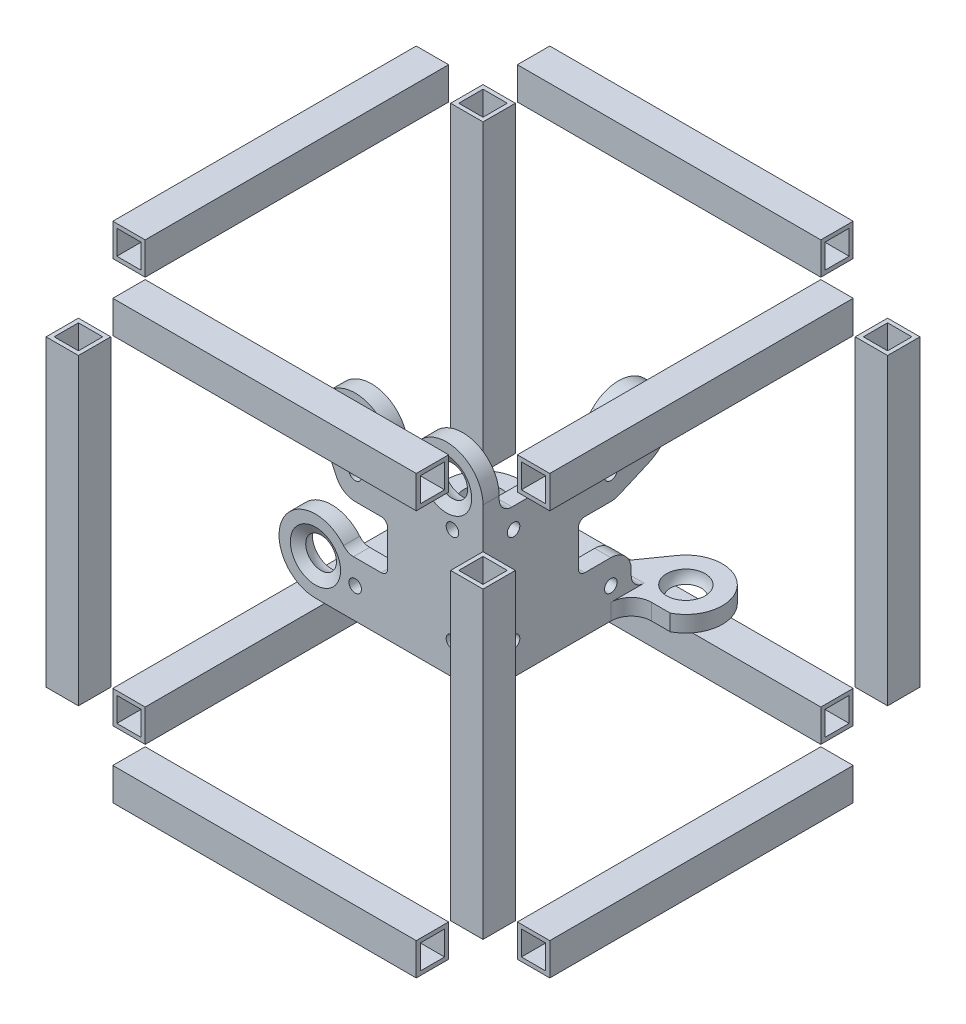
from build123d import *

# Parameters (mm, degrees)
TUBES1_START          = -12.5
SKETCH1_W             = 8
SKETCH1_H             = 8
SKETCH1_W_2           = 6
SKETCH1_H_2           = 6
TUBES1_DEPTH          = 75
TUBES1_2_DEPTH        = 75
TUBES1_3_DEPTH        = 75
TUBES1_4_DEPTH        = 75
TUBES2_START          = -16.5
SKETCH9_W             = 8
SKETCH9_H             = 8
SKETCH9_W_2           = 6
SKETCH9_H_2           = 6
TUBES2_DEPTH          = 75
TUBES2_2_DEPTH        = 75
TUBES2_3_DEPTH        = 75
TUBES2_4_DEPTH        = 75
TUBES3_START          = 16.5
SKETCH10_W            = 8
SKETCH10_H            = 8
SKETCH10_W_2          = 6
SKETCH10_H_2          = 6
TUBES3_DEPTH          = 75
TUBES3_2_DEPTH        = 75
TUBES3_3_DEPTH        = 75
TUBES3_4_DEPTH        = 75
SKETCH12_R            = 1.55
BOSS_EXTRUDE6_DEPTH   = 4
BODY_MOVE_COPY1_ANGLE = 180
BODY_MOVE_COPY3_ANGLE = 120
BOSS_EXTRUDE7_DEPTH   = 36.64081528
CUT_EXTRUDE1_START    = -4
SKETCH18_R            = 1.55
SKETCH18_W            = 13.07081528
SKETCH18_H            = 12
CUT_EXTRUDE1_DEPTH    = 2.499185
CUT_EXTRUDE2_START    = -4
SKETCH19_R            = 1.55
SKETCH19_W            = 13.07081528
SKETCH19_H            = 12
CUT_EXTRUDE2_DEPTH    = 2.499185
FILLET2_R             = 5.05
CHAMFER1_SIZE         = 0.93
SKETCH27_R            = 3.175
CABLE1_DEPTH          = 4
SKETCH28_R            = 3.175
CABLE2_DEPTH          = 4
SKETCH29_R            = 3.175
CABLE_3_DEPTH         = 4
CABLE_START           = -16.928203
SKETCH33_R            = 1.75
CABLE_5_DEPTH         = 9.115197
SKETCH34_R            = 3.175
CABLE6_DEPTH          = 4
SKETCH35_R            = 3.175
CABLE7_DEPTH          = 4
FILLET4_R             = 1.5875
SKETCH43_R            = 3.175
CABLE_4_DEPTH         = 4
CHAMFER2_SIZE         = 3.031088913
CHAMFER2_SIZE_2       = 1.75
FILLET6_R             = 6.35
FILLET7_R             = 3.175
FILLET8_R             = 5


with BuildPart() as part:
    # Sketch1 → Tubes1 (new body)
    with BuildSketch(Plane.XY.offset(50).offset(TUBES1_START)):
        with Locations((-50, 50)):
            Rectangle(SKETCH1_W, SKETCH1_H)
        with Locations((-50, 50)):
            Rectangle(SKETCH1_W_2, SKETCH1_H_2, mode=Mode.SUBTRACT)
    extrude(amount=-TUBES1_DEPTH)


with BuildPart() as body_2:
    # Sketch1 → Tubes1 2 (new body)
    with BuildSketch(Plane.XY.offset(50).offset(TUBES1_START)):
        with Locations((50, 50)):
            Rectangle(SKETCH1_W, SKETCH1_H)
        with Locations((50, 50)):
            Rectangle(SKETCH1_W_2, SKETCH1_H_2, mode=Mode.SUBTRACT)
    extrude(amount=-TUBES1_2_DEPTH)


with BuildPart() as body_3:
    # Sketch1 → Tubes1 3 (new body)
    with BuildSketch(Plane.XY.offset(50).offset(TUBES1_START)):
        with Locations((50, -50)):
            Rectangle(SKETCH1_W, SKETCH1_H)
        with Locations((50, -50)):
            Rectangle(SKETCH1_W_2, SKETCH1_H_2, mode=Mode.SUBTRACT)
    extrude(amount=-TUBES1_3_DEPTH)


with BuildPart() as body_4:
    # Sketch1 → Tubes1 4 (new body)
    with BuildSketch(Plane.XY.offset(50).offset(TUBES1_START)):
        with Locations((-50, -50)):
            Rectangle(SKETCH1_W, SKETCH1_H)
        with Locations((-50, -50)):
            Rectangle(SKETCH1_W_2, SKETCH1_H_2, mode=Mode.SUBTRACT)
    extrude(amount=-TUBES1_4_DEPTH)


with BuildPart() as body_5:
    # Sketch9 → Tubes2 (new body)
    with BuildSketch(Plane(origin=(0, -54, 0), x_dir=(0, 0, -1), z_dir=(0, -1, 0)).offset(TUBES2_START)):
        with Locations((-50, 50)):
            Rectangle(SKETCH9_W, SKETCH9_H)
        with Locations((-50, 50)):
            Rectangle(SKETCH9_W_2, SKETCH9_H_2, mode=Mode.SUBTRACT)
    extrude(amount=-TUBES2_DEPTH)


with BuildPart() as body_6:
    # Sketch9 → Tubes2 2 (new body)
    with BuildSketch(Plane(origin=(0, -54, 0), x_dir=(0, 0, -1), z_dir=(0, -1, 0)).offset(TUBES2_START)):
        with Locations((50, 50)):
            Rectangle(SKETCH9_W, SKETCH9_H)
        with Locations((50, 50)):
            Rectangle(SKETCH9_W_2, SKETCH9_H_2, mode=Mode.SUBTRACT)
    extrude(amount=-TUBES2_2_DEPTH)


with BuildPart() as body_7:
    # Sketch9 → Tubes2 3 (new body)
    with BuildSketch(Plane(origin=(0, -54, 0), x_dir=(0, 0, -1), z_dir=(0, -1, 0)).offset(TUBES2_START)):
        with Locations((50, -50)):
            Rectangle(SKETCH9_W, SKETCH9_H)
        with Locations((50, -50)):
            Rectangle(SKETCH9_W_2, SKETCH9_H_2, mode=Mode.SUBTRACT)
    extrude(amount=-TUBES2_3_DEPTH)


with BuildPart() as body_8:
    # Sketch9 → Tubes2 4 (new body)
    with BuildSketch(Plane(origin=(0, -54, 0), x_dir=(0, 0, -1), z_dir=(0, -1, 0)).offset(TUBES2_START)):
        with Locations((-50, -50)):
            Rectangle(SKETCH9_W, SKETCH9_H)
        with Locations((-50, -50)):
            Rectangle(SKETCH9_W_2, SKETCH9_H_2, mode=Mode.SUBTRACT)
    extrude(amount=-TUBES2_4_DEPTH)


with BuildPart() as body_9:
    # Sketch10 → Tubes3 (new body)
    with BuildSketch(Plane(origin=(-54, 0, 0), x_dir=(0, -1, 0), z_dir=(1, 0, 0)).offset(TUBES3_START)):
        with Locations((-50, 50)):
            Rectangle(SKETCH10_W, SKETCH10_H)
        with Locations((-50, 50)):
            Rectangle(SKETCH10_W_2, SKETCH10_H_2, mode=Mode.SUBTRACT)
    extrude(amount=TUBES3_DEPTH)


with BuildPart() as body_10:
    # Sketch10 → Tubes3 2 (new body)
    with BuildSketch(Plane(origin=(-54, 0, 0), x_dir=(0, -1, 0), z_dir=(1, 0, 0)).offset(TUBES3_START)):
        with Locations((50, 50)):
            Rectangle(SKETCH10_W, SKETCH10_H)
        with Locations((50, 50)):
            Rectangle(SKETCH10_W_2, SKETCH10_H_2, mode=Mode.SUBTRACT)
    extrude(amount=TUBES3_2_DEPTH)


with BuildPart() as body_11:
    # Sketch10 → Tubes3 3 (new body)
    with BuildSketch(Plane(origin=(-54, 0, 0), x_dir=(0, -1, 0), z_dir=(1, 0, 0)).offset(TUBES3_START)):
        with Locations((50, -50)):
            Rectangle(SKETCH10_W, SKETCH10_H)
        with Locations((50, -50)):
            Rectangle(SKETCH10_W_2, SKETCH10_H_2, mode=Mode.SUBTRACT)
    extrude(amount=TUBES3_3_DEPTH)


with BuildPart() as body_12:
    # Sketch10 → Tubes3 4 (new body)
    with BuildSketch(Plane(origin=(-54, 0, 0), x_dir=(0, -1, 0), z_dir=(1, 0, 0)).offset(TUBES3_START)):
        with Locations((-50, -50)):
            Rectangle(SKETCH10_W, SKETCH10_H)
        with Locations((-50, -50)):
            Rectangle(SKETCH10_W_2, SKETCH10_H_2, mode=Mode.SUBTRACT)
    extrude(amount=TUBES3_4_DEPTH)


with BuildPart() as body_13:
    # Sketch12 → Boss-Extrude6 (new body)
    with BuildSketch(Plane.ZY.offset(-19.57)):
        Polygon((17.07081528, -17.07081528), (17.07081528, 17.07081528), (-17.07081528, 17.07081528), (-17.07081528, 6), (-4, 6), (-4, -6), (-17.07081528, -6), (-17.07081528, -17.07081528), align=None)
        with Locations(Location((-12.02081528, -12.02081528, 0), (0, 0, 270))):
            Circle(SKETCH12_R, mode=Mode.SUBTRACT)
        with Locations(Location((12.02081528, -12.02081528, 0), (0, 0, 270))):
            Circle(SKETCH12_R, mode=Mode.SUBTRACT)
        with Locations(Location((12.02081528, 12.02081528, 0), (0, 0, 270))):
            Circle(SKETCH12_R, mode=Mode.SUBTRACT)
        with Locations(Location((-12.02081528, 12.02081528, 0), (0, 0, 270))):
            Circle(SKETCH12_R, mode=Mode.SUBTRACT)
    extrude(amount=BOSS_EXTRUDE6_DEPTH)


with BuildPart() as body_14:
    # Body-Move/Copy1: copy of body 13
    add(body_13.part.moved(Location((0, 0, 0))).rotate(Axis((9.285, 0, -9.285), (0.7071067811865488, 0, 0.7071067811865462)), BODY_MOVE_COPY1_ANGLE))


with BuildPart() as body_14_1:
    # Body-Move/Copy2: moved
    add(body_14.part.moved(Location((-18.57, 0, 18.57))))


with BuildPart() as body_15:
    # Body-Move/Copy3: copy of body 14
    add(body_14_1.part.moved(Location((0, 0, 0))).rotate(Axis((-6.19, 6.19, 12.38), (0.5773502691896252, -0.5773502691896252, 0.5773502691896272)), BODY_MOVE_COPY3_ANGLE))


with BuildPart() as body_15_1:
    # Body-Move/Copy4: moved
    add(body_15.part.moved(Location((0, -18.57, -18.57))))

    # Combine1: union body 14, body 13
    add(body_14_1.part)
    add(body_13.part)

    # Sketch13 → Boss-Extrude7 (add)
    with BuildSketch(Plane.XZ.offset(19.57)):
        Polygon((19.57, 19.57), (-17.07081528, 19.57), (-17.07081528, 17.07081528), (17.07081528, 17.07081528), (17.07081528, -17.07081528), (19.57, -17.07081528), (19.57, 17.07081528), align=None)
    extrude(amount=-BOSS_EXTRUDE7_DEPTH)

    # Sketch18 → Cut-Extrude1 (cut)
    with BuildSketch(Plane(origin=(0, 0, 15.57), x_dir=(-1, 0, 0), z_dir=(0, 0, -1)).offset(CUT_EXTRUDE1_START)):
        with Locations((-12.02081528, 12.02081528)):
            Circle(SKETCH18_R)
        with Locations((12.02081528, 12.02081528)):
            Circle(SKETCH18_R)
        with Locations((12.02081528, -12.02081528)):
            Circle(SKETCH18_R)
        with Locations((-12.02081528, -12.02081528)):
            Circle(SKETCH18_R)
        with Locations((10.53540764, 0)):
            Rectangle(SKETCH18_W, SKETCH18_H)
    extrude(amount=CUT_EXTRUDE1_DEPTH, mode=Mode.SUBTRACT)

    # Sketch19 → Cut-Extrude2 (cut)
    with BuildSketch(Plane.ZY.offset(-15.57).offset(CUT_EXTRUDE2_START)):
        with Locations(Location((-12.02081528, 12.02081528, 0), (0, 0, 270))):
            Circle(SKETCH19_R)
        with Locations(Location((12.02081528, 12.02081528, 0), (0, 0, 270))):
            Circle(SKETCH19_R)
        with Locations(Location((12.02081528, -12.02081528, 0), (0, 0, 270))):
            Circle(SKETCH19_R)
        with Locations(Location((-12.02081528, -12.02081528, 0), (0, 0, 270))):
            Circle(SKETCH19_R)
        with Locations((-10.53540764, 0)):
            Rectangle(SKETCH19_W, SKETCH19_H)
    extrude(amount=CUT_EXTRUDE2_DEPTH, mode=Mode.SUBTRACT)

    # Fillet2
    fillet2_edges = [body_15_1.edges().sort_by_distance(p)[0] for p in [
        (6, -17.57, -17.07081528),
        (-17.07081528, -17.57, -17.07081528),
        (-6, -17.57, -17.07081528),
        (17.57, -6, -17.07081528),
        (-17.07081528, 6, 17.57),
        (-17.07081528, 17.07081528, 17.57),
        (-17.07081528, -6, 17.57),
        (17.57, 17.07081528, -17.07081528),
        (17.57, 6, -17.07081528),
    ]]
    fillet(fillet2_edges, radius=FILLET2_R)

    # Chamfer1
    # the kernel refuses this chamfer: 0.93 mm, written as the material it takes off along each edge
    with BuildSketch(Plane(origin=(12.02081528, -15.57, -12.02081528), x_dir=(-1, 0, 0), z_dir=(0, 0, -1))) as chamfer1_piece_1:
        Polygon((1.55, -CHAMFER1_SIZE), (1.55 + CHAMFER1_SIZE, 0), (1.55, 0), align=None)
    revolve(axis=Axis((12.02081528, -15.57, -12.02081528), (0, 1, 0)), mode=Mode.SUBTRACT)
    with BuildSketch(Plane(origin=(12.02081528, -15.57, 12.02081528), x_dir=(-1, 0, 0), z_dir=(0, 0, -1))) as chamfer1_piece_2:
        Polygon((1.55, -CHAMFER1_SIZE), (1.55 + CHAMFER1_SIZE, 0), (1.55, 0), align=None)
    revolve(axis=Axis((12.02081528, -15.57, 12.02081528), (0, 1, 0)), mode=Mode.SUBTRACT)
    with BuildSketch(Plane(origin=(-12.02081528, -15.57, 12.02081528), x_dir=(-1, 0, 0), z_dir=(0, 0, -1))) as chamfer1_piece_3:
        Polygon((1.55, -CHAMFER1_SIZE), (1.55 + CHAMFER1_SIZE, 0), (1.55, 0), align=None)
    revolve(axis=Axis((-12.02081528, -15.57, 12.02081528), (0, 1, 0)), mode=Mode.SUBTRACT)
    with BuildSketch(Plane(origin=(-12.02081528, -15.57, -12.02081528), x_dir=(-1, 0, 0), z_dir=(0, 0, -1))) as chamfer1_piece_4:
        Polygon((1.55, -CHAMFER1_SIZE), (1.55 + CHAMFER1_SIZE, 0), (1.55, 0), align=None)
    revolve(axis=Axis((-12.02081528, -15.57, -12.02081528), (0, 1, 0)), mode=Mode.SUBTRACT)
    with BuildSketch(Plane(origin=(-12.02081528, 12.02081528, 15.57), x_dir=(0, 1, 0), z_dir=(-1, 0, 0))) as chamfer1_piece_5:
        Polygon((1.55, -CHAMFER1_SIZE), (1.55 + CHAMFER1_SIZE, 0), (1.55, 0), align=None)
    revolve(axis=Axis((-12.02081528, 12.02081528, 15.57), (0, 0, -1)), mode=Mode.SUBTRACT)
    with BuildSketch(Plane(origin=(12.02081528, 12.02081528, 15.57), x_dir=(0, 1, 0), z_dir=(-1, 0, 0))) as chamfer1_piece_6:
        Polygon((1.55, -CHAMFER1_SIZE), (1.55 + CHAMFER1_SIZE, 0), (1.55, 0), align=None)
    revolve(axis=Axis((12.02081528, 12.02081528, 15.57), (0, 0, -1)), mode=Mode.SUBTRACT)
    with BuildSketch(Plane(origin=(12.02081528, -12.02081528, 15.57), x_dir=(0, 1, 0), z_dir=(-1, 0, 0))) as chamfer1_piece_7:
        Polygon((1.55, -CHAMFER1_SIZE), (1.55 + CHAMFER1_SIZE, 0), (1.55, 0), align=None)
    revolve(axis=Axis((12.02081528, -12.02081528, 15.57), (0, 0, -1)), mode=Mode.SUBTRACT)
    with BuildSketch(Plane(origin=(-12.02081528, -12.02081528, 15.57), x_dir=(0, 1, 0), z_dir=(-1, 0, 0))) as chamfer1_piece_8:
        Polygon((1.55, -CHAMFER1_SIZE), (1.55 + CHAMFER1_SIZE, 0), (1.55, 0), align=None)
    revolve(axis=Axis((-12.02081528, -12.02081528, 15.57), (0, 0, -1)), mode=Mode.SUBTRACT)
    with BuildSketch(Plane(origin=(15.57, -12.02081528, -12.02081528), x_dir=(0, -1, 0), z_dir=(0, 0, -1))) as chamfer1_piece_9:
        Polygon((1.55 + CHAMFER1_SIZE, 0), (1.55, -CHAMFER1_SIZE), (1.55, 0), align=None)
    revolve(axis=Axis((15.57, -12.02081528, -12.02081528), (-1, 0, 0)), mode=Mode.SUBTRACT)
    with BuildSketch(Plane(origin=(15.57, -12.02081528, 12.02081528), x_dir=(0, -1, 0), z_dir=(0, 0, -1))) as chamfer1_piece_10:
        Polygon((1.55 + CHAMFER1_SIZE, 0), (1.55, -CHAMFER1_SIZE), (1.55, 0), align=None)
    revolve(axis=Axis((15.57, -12.02081528, 12.02081528), (-1, 0, 0)), mode=Mode.SUBTRACT)
    with BuildSketch(Plane(origin=(15.57, 12.02081528, 12.02081528), x_dir=(0, -1, 0), z_dir=(0, 0, -1))) as chamfer1_piece_11:
        Polygon((1.55 + CHAMFER1_SIZE, 0), (1.55, -CHAMFER1_SIZE), (1.55, 0), align=None)
    revolve(axis=Axis((15.57, 12.02081528, 12.02081528), (-1, 0, 0)), mode=Mode.SUBTRACT)
    with BuildSketch(Plane(origin=(15.57, 12.02081528, -12.02081528), x_dir=(0, -1, 0), z_dir=(0, 0, -1))) as chamfer1_piece_12:
        Polygon((1.55 + CHAMFER1_SIZE, 0), (1.55, -CHAMFER1_SIZE), (1.55, 0), align=None)
    revolve(axis=Axis((15.57, 12.02081528, -12.02081528), (-1, 0, 0)), mode=Mode.SUBTRACT)

    # Sketch27 → Cable1 (add)
    with BuildSketch(Plane(origin=(0, 0, 15.57), x_dir=(-1, 0, 0), z_dir=(0, 0, -1))):
        with BuildLine():
            Line((20.149230994, 16.387027244), (16.581759653, 8.881985602))
            ThreePointArc((16.581759653, 8.881985602), (16.947034372, 9.938754996), (17.07081528, 11.05))
            Line((17.07081528, 11.05), (17.07081528, 12.02081528))
            ThreePointArc((17.07081528, 12.02081528), (15.591704525, 15.591704525), (12.02081528, 17.07081528))
            Line((12.02081528, 17.07081528), (3.02081528, 17.07081528))
            Line((3.02081528, 17.07081528), (3.02081528, 20.25081528))
            ThreePointArc((3.02081528, 20.25081528), (14.001251921, 29.030215642), (20.149230994, 16.387027244))
        make_face()
        with Locations((12.02081528, 20.25081528)):
            Circle(SKETCH27_R, mode=Mode.SUBTRACT)
    extrude(amount=-CABLE1_DEPTH)

    # Sketch28 → Cable2 (add)
    with BuildSketch(Plane(origin=(0, 0, 15.57), x_dir=(-1, 0, 0), z_dir=(0, 0, -1))):
        with BuildLine():
            Line((-19.57, 21.07081528), (-19.57, 17.07081528))
            Line((-19.57, 17.07081528), (-1.57, 17.07081528))
            Line((-1.57, 17.07081528), (-1.57, 21.07081528))
            ThreePointArc((-1.57, 21.07081528), (-10.57, 30.07081528), (-19.57, 21.07081528))
        make_face()
        with Locations((-10.57, 21.07081528)):
            Circle(SKETCH28_R, mode=Mode.SUBTRACT)
    extrude(amount=-CABLE2_DEPTH)

    # Sketch33 → Cable 5 (cut)
    with BuildSketch(Plane(origin=(9.796487764, -9.796502297, 9.796501863), x_dir=(0.8164969786402893, 0.4082479017987434, -0.4082478837032751), z_dir=(-0.5773497067387141, 0.577350563210323, -0.577350537619429)).offset(CABLE_START)):
        with Locations(Location((0, 0, 0), (0, 0, 267.911468754))):
            Circle(SKETCH33_R)
    extrude(amount=CABLE_5_DEPTH, mode=Mode.SUBTRACT)

    # Sketch34 → Cable6 (add)
    with BuildSketch(Plane(origin=(0, 0, 15.57), x_dir=(-1, 0, 0), z_dir=(0, 0, -1))):
        with BuildLine():
            Line((17.07081528, -19.57), (21.84081528, -19.57))
            ThreePointArc((21.84081528, -19.57), (29.655225047, -6.10513718), (14.087422474, -6))
            Line((14.087422474, -6), (12.02081528, -6))
            ThreePointArc((12.02081528, -6), (15.591704525, -7.479110755), (17.07081528, -11.05))
            Line((17.07081528, -11.05), (17.07081528, -15.57))
            Line((17.07081528, -15.57), (17.07081528, -19.57))
        make_face()
        with Locations((21.84081528, -10.57)):
            Circle(SKETCH34_R, mode=Mode.SUBTRACT)
    extrude(amount=-CABLE6_DEPTH)

    # Sketch35 → Cable7 (add)
    with BuildSketch(Plane(origin=(0, -15.57, 0), x_dir=(1, 0, 0), z_dir=(0, 1, 0))):
        with BuildLine():
            Line((-17.07081528, 12.02081528), (-17.07081528, 4.344523779))
            Line((-17.07081528, 4.344523779), (-24.383145751, 11.656854249))
            ThreePointArc((-24.383145751, 11.656854249), (-21.463335611, 26.335731073), (-9.01918472, 18.02081528))
            Line((-9.01918472, 18.02081528), (-9.01918472, 16.644481498))
            ThreePointArc((-9.01918472, 16.644481498), (-10.012458291, 16.963082695), (-11.05, 17.07081528))
            Line((-11.05, 17.07081528), (-12.02081528, 17.07081528))
            ThreePointArc((-12.02081528, 17.07081528), (-15.591704525, 15.591704525), (-17.07081528, 12.02081528))
        make_face()
        with Locations(Location((-18.01918472, 18.02081528, 0), (0, 0, 270))):
            Circle(SKETCH35_R, mode=Mode.SUBTRACT)
    extrude(amount=-CABLE7_DEPTH)

    # Sketch37 → Cable 1 (revolve, cut)
    with BuildSketch(Plane(origin=(-12.02081528, 0, 0), x_dir=(0, 0, -1), z_dir=(1, 0, 0))):
        with BuildLine():
            Line((-20.07, 20.25081528), (-10.545, 20.25081528))
            ThreePointArc((-10.545, 20.25081528), (-15.3075, 25.01331528), (-20.07, 20.25081528))
        make_face()
    revolve(axis=Axis((-12.02081528, 20.25081528, 20.07), (0, 0, -1)), mode=Mode.SUBTRACT)

    # Sketch38 → Cable 2 (revolve, cut)
    with BuildSketch(Plane.ZY.offset(-10.57)):
        with BuildLine():
            Line((10.545, 21.07081528), (20.07, 21.07081528))
            ThreePointArc((20.07, 21.07081528), (15.3075, 25.83331528), (10.545, 21.07081528))
        make_face()
    revolve(axis=Axis((10.57, 21.07081528, 10.545), (0, 0, 1)), mode=Mode.SUBTRACT)


with BuildPart() as body_14_2:
    # Sketch29 → Cable 3 (new body)
    with BuildSketch(Plane.ZY.offset(-15.57)):
        with BuildLine():
            Line((-21.506894245, 9.66682592), (-14.033918958, 6.418594859))
            ThreePointArc((-14.033918958, 6.418594859), (-16.243887241, 8.280855148), (-17.07081528, 11.05))
            Line((-17.07081528, 11.05), (-17.07081528, 12.02081528))
            ThreePointArc((-17.07081528, 12.02081528), (-15.591704525, 15.591704525), (-12.02081528, 17.07081528))
            Line((-12.02081528, 17.07081528), (-4.341262658, 17.07081528))
            Line((-4.341262658, 17.07081528), (-11.555223689, 24.284776311))
            ThreePointArc((-11.555223689, 24.284776311), (-25.35880914, 22.985594494), (-21.506894245, 9.66682592))
        make_face()
        with Locations(Location((-17.91918472, 17.92081528, 0), (0, 0, 270))):
            Circle(SKETCH29_R, mode=Mode.SUBTRACT)
    extrude(amount=-CABLE_3_DEPTH)


with BuildPart() as cable3_tool:
    # Sketch39 → Cable3 (revolve)
    with BuildSketch(Plane(origin=(0, 0, -17.91918472), x_dir=(-1, 0, 0), z_dir=(0, 0, -1))):
        with BuildLine():
            Line((-20.07, 17.92081528), (-10.545, 17.92081528))
            ThreePointArc((-10.545, 17.92081528), (-15.3075, 22.68331528), (-20.07, 17.92081528))
        make_face()
    revolve(axis=Axis((20.07, 17.92081528, -17.91918472), (-1, 0, 0)))


with BuildPart() as body_15_2:
    add(body_15_1.part)

    # Cable3: cut by cable3_tool
    add(cable3_tool.part, mode=Mode.SUBTRACT)


with BuildPart() as body_14_2_1:
    add(body_14_2.part)

    # Cable3: cut by cable3_tool
    add(cable3_tool.part, mode=Mode.SUBTRACT)


with BuildPart() as body_15_3:
    add(body_15_2.part)

    # Combine2: union body 14 2
    add(body_14_2_1.part)

    # Sketch41 → cable5 (revolve, cut)
    with BuildSketch(Plane.ZY.offset(18.01918472)):
        with BuildLine():
            Line((-18.02081528, -10.545), (-18.02081528, -20.07))
            ThreePointArc((-18.02081528, -20.07), (-22.78331528, -15.3075), (-18.02081528, -10.545))
        make_face()
    revolve(axis=Axis((-18.01918472, -10.545, -18.02081528), (0, -1, 0)), mode=Mode.SUBTRACT)

    # Sketch42 → cable 6 (revolve, cut)
    with BuildSketch(Plane.ZY.offset(21.84081528)):
        with BuildLine():
            Line((10.545, -10.57), (20.07, -10.57))
            ThreePointArc((20.07, -10.57), (15.3075, -5.8075), (10.545, -10.57))
        make_face()
    revolve(axis=Axis((-21.84081528, -10.57, 10.545), (0, 0, 1)), mode=Mode.SUBTRACT)

    # Fillet4
    fillet4_edges = [body_15_3.edges().sort_by_distance(p)[0] for p in [
        (-6, -17.57, -4),
        (6, -17.57, -4),
        (-4, 6, 17.57),
        (-4, -6, 17.57),
        (17.57, -6, -4),
        (17.57, 6, -4),
    ]]
    fillet(fillet4_edges, radius=FILLET4_R)

    # Sketch43 → Cable 4 (add)
    with BuildSketch(Plane(origin=(0, -15.57, 0), x_dir=(1, 0, 0), z_dir=(0, 1, 0))):
        with BuildLine():
            Line((17.711377599, 30.251781716), (6.920995209, 14.928360539))
            ThreePointArc((6.920995209, 14.928360539), (8.724124203, 16.503314781), (11.05, 17.07081528))
            Line((11.05, 17.07081528), (19.57, 17.07081528))
            Line((19.57, 17.07081528), (29.194652426, 17.07081528))
            ThreePointArc((29.194652426, 17.07081528), (31.855949417, 30.981945705), (17.711377599, 30.251781716))
        make_face()
        with Locations(Location((25.07, 25.070017888, 0), (0, 0, 270))):
            Circle(SKETCH43_R, mode=Mode.SUBTRACT)
    extrude(amount=-CABLE_4_DEPTH)

    # Sketch44 → cable4 (revolve, cut)
    with BuildSketch(Plane(origin=(25.07, 0, 0), x_dir=(0, 0, -1), z_dir=(1, 0, 0))):
        with BuildLine():
            Line((25.070017888, -10.545), (25.070017888, -20.07))
            ThreePointArc((25.070017888, -20.07), (20.307517888, -15.3075), (25.070017888, -10.545))
        make_face()
    revolve(axis=Axis((25.07, -10.545, -25.070017888), (0, -1, 0)), mode=Mode.SUBTRACT)

    # Chamfer2
    # the kernel refuses this chamfer: 3.031088913, 1.75 mm, written as the material it takes off along each edge
    with BuildSketch(Plane(origin=(-21.84081528, -10.57, 19.57), x_dir=(-1, 0, 0), z_dir=(0, -1, 0))) as chamfer2_piece_1:
        Polygon((3.175 + CHAMFER2_SIZE, 0), (3.175, CHAMFER2_SIZE_2), (3.175, 0), align=None)
    revolve(axis=Axis((-21.84081528, -10.57, 19.57), (0, 0, -1)), mode=Mode.SUBTRACT)
    with BuildSketch(Plane(origin=(-12.02081528, 20.25081528, 19.57), x_dir=(-1, 0, 0), z_dir=(0, -1, 0))) as chamfer2_piece_2:
        Polygon((3.175 + CHAMFER2_SIZE, 0), (3.175, CHAMFER2_SIZE_2), (3.175, 0), align=None)
    revolve(axis=Axis((-12.02081528, 20.25081528, 19.57), (0, 0, -1)), mode=Mode.SUBTRACT)
    with BuildSketch(Plane(origin=(10.57, 21.07081528, 19.57), x_dir=(-1, 0, 0), z_dir=(0, -1, 0))) as chamfer2_piece_3:
        Polygon((3.175 + CHAMFER2_SIZE, 0), (3.175, CHAMFER2_SIZE_2), (3.175, 0), align=None)
    revolve(axis=Axis((10.57, 21.07081528, 19.57), (0, 0, -1)), mode=Mode.SUBTRACT)
    with BuildSketch(Plane(origin=(19.57, 17.92081528, -17.91918472), x_dir=(0, -1, 0), z_dir=(0, 0, -1))) as chamfer2_piece_4:
        Polygon((3.175 + CHAMFER2_SIZE, 0), (3.175, CHAMFER2_SIZE_2), (3.175, 0), align=None)
    revolve(axis=Axis((19.57, 17.92081528, -17.91918472), (-1, 0, 0)), mode=Mode.SUBTRACT)
    with BuildSketch(Plane(origin=(-18.01918472, -19.57, -18.02081528), x_dir=(0, 0, 1), z_dir=(-1, 0, 0))) as chamfer2_piece_5:
        Polygon((3.175 + CHAMFER2_SIZE, 0), (3.175, CHAMFER2_SIZE_2), (3.175, 0), align=None)
    revolve(axis=Axis((-18.01918472, -19.57, -18.02081528), (0, 1, 0)), mode=Mode.SUBTRACT)
    with BuildSketch(Plane(origin=(25.07, -19.57, -25.070017888), x_dir=(0, 0, 1), z_dir=(-1, 0, 0))) as chamfer2_piece_6:
        Polygon((3.175 + CHAMFER2_SIZE, 0), (3.175, CHAMFER2_SIZE_2), (3.175, 0), align=None)
    revolve(axis=Axis((25.07, -19.57, -25.070017888), (0, 1, 0)), mode=Mode.SUBTRACT)

    # Fillet6
    # the kernel refuses this fillet: 6.35 mm, written as the material it adds along each edge
    with BuildSketch(Plane(origin=(-17.07081528, -15.57, -4.344523779), x_dir=(-0.7071067811865492, -4.872621993956222e-15, -0.7071067811865458), z_dir=(0, -1, 0))) as fillet6_piece_1:
        with BuildLine():
            CenterArc((FILLET6_R * 0.414213562373, -FILLET6_R), FILLET6_R, 90, 45)
            Line((-FILLET6_R * 0.292893218813, -FILLET6_R * 0.292893218813), (0, 0))
            Line((0, 0), (FILLET6_R * 0.414213562373, 0))
        make_face()
    extrude(amount=4)
    with BuildSketch(Plane(origin=(-9.01918472, -15.57, -16.644481498), x_dir=(0.8180891707136062, 4.788971450513196e-15, 0.5750913916597291), z_dir=(0, -1, 0))) as fillet6_piece_2:
        with BuildLine():
            CenterArc((3.249746855, -6.224855518), FILLET6_R, 101.393901503, 36.588217675)
            Line((-1.467896539, -1.974403682), (-1.939660878, -1.549358498))
            ThreePointArc((-1.939660878, -1.549358498), (-1.311004333, -0.760780728), (-0.519486623, 0.365183034))
            Line((-0.519486623, 0.365183034), (0.125446155, 0.622485552))
            ThreePointArc((0.125446155, 0.622485552), (0.997642652, 0.535475648), (1.869839148, 0.622485552))
            Line((1.869839148, 0.622485552), (1.995285303, 0))
        make_face()
    extrude(amount=4)
    with BuildSketch(Plane(origin=(15.57, 17.07081528, -4.341262658), x_dir=(0, 0.7071067811865485, -0.7071067811865467), z_dir=(1, 0, 0))) as fillet6_piece_3:
        with BuildLine():
            CenterArc((FILLET6_R * 0.414213562335, FILLET6_R), FILLET6_R, 225, 45)
            Line((-FILLET6_R * 0.292893218852, FILLET6_R * 0.292893218813), (0, 0))
            Line((0, 0), (FILLET6_R * 0.414213562335, 0))
        make_face()
    extrude(amount=4)
    # the kernel refuses this fillet: 6.35 mm, written as the material it takes off along each edge

    # Fillet7
    # the kernel refuses this fillet: 3.175 mm, written as the material it adds along each edge
    with BuildSketch(Plane(origin=(-3.02081528, 17.07081528, 15.57), x_dir=(0, 1, 0), z_dir=(0, 0, 1)), Plane(origin=(1.57, 17.07081528, 15.57), x_dir=(-1.0, -5.391173072271139e-11, 3.491481338848094e-15), z_dir=(0, 0, 1)), Plane(origin=(19.57, 17.07081528, 15.57), x_dir=(-3.491481338843133e-15, -5.389270831876064e-11, -1.0), z_dir=(-1, 0, 0)), Plane(origin=(-17.07081528, -19.57, 15.57), x_dir=(-1, 0, 0), z_dir=(0, 1, 0))) as fillet7_piece_1:
        with BuildLine():
            CenterArc((FILLET7_R, -FILLET7_R), FILLET7_R, 90, 90)
            Line((-FILLET7_R * 5.38904703889e-11, -FILLET7_R), (0, 0))
            Line((0, 0), (FILLET7_R, 0))
        make_face()
    extrude(amount=4)
    with BuildSketch(Plane(origin=(-14.087422474, -6, 15.57), x_dir=(1, 0, 0), z_dir=(0, 0, 1))) as fillet7_piece_2:
        with BuildLine():
            CenterArc((1.640520117, 3.175), FILLET7_R, 219.504560062, 50.495439938)
            ThreePointArc((-0.809227195, 1.155256674), (-0.381947198, 0.593505559), (0, 0))
            Line((0, 0), (1.640520117, 0))
        make_face()
    extrude(amount=4)
    with BuildSketch(Plane(origin=(19.57, -15.57, -17.07081528), x_dir=(0, 1, 0), z_dir=(-1, 0, 0))) as fillet7_piece_3:
        with BuildLine():
            CenterArc((FILLET7_R, FILLET7_R), FILLET7_R, 180, 90)
            Line((0, FILLET7_R), (0, 0))
            Line((0, 0), (FILLET7_R, 0))
        make_face()
    extrude(amount=4)

    # Fillet8
    fillet8_edges = [body_15_3.edges().sort_by_distance(p)[0] for p in [
        (19.57, -17.57, -17.07081528),
    ]]
    fillet(fillet8_edges, radius=FILLET8_R)


solid = Compound([part.part, body_2.part, body_3.part, body_4.part, body_5.part, body_6.part, body_7.part, body_8.part, body_9.part, body_10.part, body_11.part, body_12.part, body_15_3.part])
